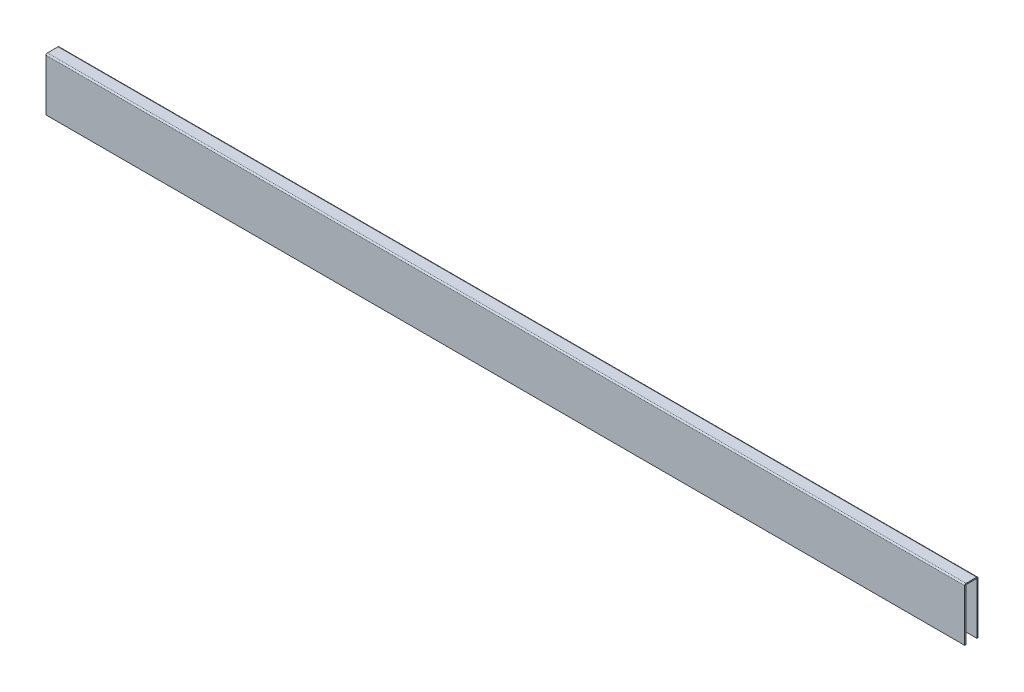
from build123d import *

# Parameters (mm, degrees)
BASE_FLANGE1_DEPTH = 50.8


# Sheet-metal steps are written as plain solids
with BuildPart() as part:
    # Sketch1 → Base-Flange1 (new, symmetric)
    with BuildSketch(Plane(origin=(0, 0, 0), x_dir=(0, 0, -1), z_dir=(1, 0, 0))):
        with BuildLine():
            Line((-0.6096, -5.7404), (-0.6096, -0.0254))
            ThreePointArc((-0.6096, -0.0254), (-0.602160512, -0.007439488), (-0.5842, 0))
            Line((-0.5842, 0), (0.5842, 0))
            ThreePointArc((0.5842, 0), (0.602160512, -0.007439488), (0.6096, -0.0254))
            Line((0.6096, -0.0254), (0.6096, -5.7404))
            Line((0.6096, -5.7404), (0.7366, -5.7404))
            Line((0.7366, -5.7404), (0.7366, -0.0254))
            ThreePointArc((0.7366, -0.0254), (0.691963073, 0.082363073), (0.5842, 0.127))
            Line((0.5842, 0.127), (-0.5842, 0.127))
            ThreePointArc((-0.5842, 0.127), (-0.691963073, 0.082363073), (-0.7366, -0.0254))
            Line((-0.7366, -0.0254), (-0.7366, -5.7404))
            Line((-0.7366, -5.7404), (-0.6096, -5.7404))
        make_face()
    extrude(amount=BASE_FLANGE1_DEPTH, both=True)


solid = part.part
